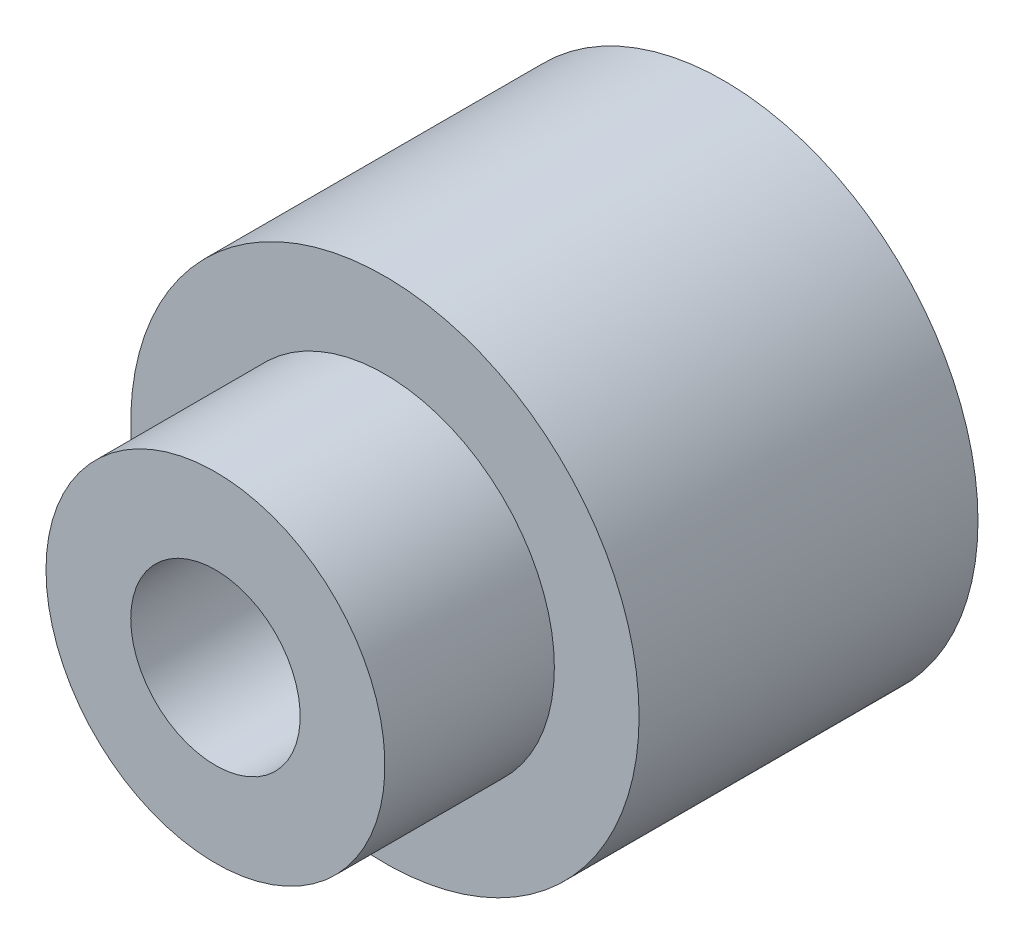
from build123d import *

# Parameters (mm, degrees)
SKETCH1_R                  = 15
BOSS_EXTRUDE1_DEPTH        = 10
SKETCH2_R                  = 10
CUT_EXTRUDE1_DEPTH         = 20
SKETCH3_R                  = 15
BOSS_EXTRUDE2_DEPTH        = 10
SKETCH5_R                  = 10
CUT_EXTRUDE3_DEPTH         = 8
SKETCH8_W                  = 0.75
SKETCH8_H                  = 0.75
CUT_EXTRUDE5_DEPTH         = 2
FILL_START                 = -1.125
FILL_PATTERN2_OUTLINE_W    = 0.75
FILL_PATTERN2_OUTLINE_H    = 2
FILL_PATTERN2_DEPTH        = 0.75
FILL_START_2               = 0.375
FILL_PATTERN2_2_OUTLINE_W  = 0.75
FILL_PATTERN2_2_OUTLINE_H  = 2
FILL_PATTERN2_2_DEPTH      = 0.75
FILL_START_3               = -3.375
FILL_PATTERN2_3_OUTLINE_W  = 0.75
FILL_PATTERN2_3_OUTLINE_H  = 2
FILL_PATTERN2_3_DEPTH      = 0.75
FILL_START_4               = -1.875
FILL_PATTERN2_4_OUTLINE_W  = 0.75
FILL_PATTERN2_4_OUTLINE_H  = 2
FILL_PATTERN2_4_DEPTH      = 0.75
FILL_START_5               = 1.125
FILL_PATTERN2_5_OUTLINE_W  = 0.75
FILL_PATTERN2_5_OUTLINE_H  = 2
FILL_PATTERN2_5_DEPTH      = 0.75
FILL_START_6               = 2.625
FILL_PATTERN2_6_OUTLINE_W  = 0.75
FILL_PATTERN2_6_OUTLINE_H  = 2
FILL_PATTERN2_6_DEPTH      = 0.75
FILL_START_7               = -4.125
FILL_PATTERN2_7_OUTLINE_W  = 0.75
FILL_PATTERN2_7_OUTLINE_H  = 2
FILL_PATTERN2_7_DEPTH      = 0.75
FILL_START_8               = -2.625
FILL_PATTERN2_8_OUTLINE_W  = 0.75
FILL_PATTERN2_8_OUTLINE_H  = 2
FILL_PATTERN2_8_DEPTH      = 0.75
FILL_START_9               = -0.375
FILL_PATTERN2_9_OUTLINE_W  = 0.75
FILL_PATTERN2_9_OUTLINE_H  = 2
FILL_PATTERN2_9_DEPTH      = 0.75
FILL_START_10              = 1.875
FILL_PATTERN2_10_OUTLINE_W = 0.75
FILL_PATTERN2_10_OUTLINE_H = 2
FILL_PATTERN2_10_DEPTH     = 0.75
FILL_START_11              = 3.375
FILL_PATTERN2_11_OUTLINE_W = 0.75
FILL_PATTERN2_11_OUTLINE_H = 2
FILL_PATTERN2_11_DEPTH     = 0.75
SKETCH12_W                 = 18
SKETCH12_H                 = 5


# Read off the part's stored shape, not the designer's step: Fill Pattern2
with BuildPart() as part:
    # Sketch1 → Boss-Extrude1 (new body)
    with BuildSketch(Plane.XY):
        Circle(SKETCH1_R)
    extrude(amount=BOSS_EXTRUDE1_DEPTH)

    # Sketch2 → Cut-Extrude1 (cut)
    with BuildSketch(Plane.XY.offset(10)):
        Circle(SKETCH2_R)
    extrude(amount=-CUT_EXTRUDE1_DEPTH, mode=Mode.SUBTRACT)

    # Sketch3 → Boss-Extrude2 (add)
    with BuildSketch(Plane.XY.offset(10)):
        Circle(SKETCH3_R)
    extrude(amount=BOSS_EXTRUDE2_DEPTH)

    # Sketch5 → Cut-Extrude3 (cut)
    with BuildSketch(Plane.XY.offset(20)):
        Circle(SKETCH5_R)
    extrude(amount=-CUT_EXTRUDE3_DEPTH, mode=Mode.SUBTRACT)

    # Sketch8 → Cut-Extrude5 (cut)
    with BuildSketch(Plane(origin=(0, 0, 10), x_dir=(-1, 0, 0), z_dir=(0, 0, -1))):
        Rectangle(SKETCH8_W, SKETCH8_H)
    extrude(amount=-CUT_EXTRUDE5_DEPTH, mode=Mode.SUBTRACT)

    # Fill Pattern2 outline → Fill Pattern2 (cut)
    with BuildSketch(Plane.YZ.offset(FILL_START)):
        with Locations((-1.299038106, 11)):
            Rectangle(FILL_PATTERN2_OUTLINE_W, FILL_PATTERN2_OUTLINE_H)
        with Locations((1.299038106, 11)):
            Rectangle(FILL_PATTERN2_OUTLINE_W, FILL_PATTERN2_OUTLINE_H)
        with Locations((-3.897114317, 11)):
            Rectangle(FILL_PATTERN2_OUTLINE_W, FILL_PATTERN2_OUTLINE_H)
        with Locations((3.897114317, 11)):
            Rectangle(FILL_PATTERN2_OUTLINE_W, FILL_PATTERN2_OUTLINE_H)
    extrude(amount=FILL_PATTERN2_DEPTH, mode=Mode.SUBTRACT)

    # Fill Pattern2 2 outline → Fill Pattern2 2 (cut)
    with BuildSketch(Plane.YZ.offset(FILL_START_2)):
        with Locations((-1.299038106, 11)):
            Rectangle(FILL_PATTERN2_2_OUTLINE_W, FILL_PATTERN2_2_OUTLINE_H)
        with Locations((1.299038106, 11)):
            Rectangle(FILL_PATTERN2_2_OUTLINE_W, FILL_PATTERN2_2_OUTLINE_H)
        with Locations((-3.897114317, 11)):
            Rectangle(FILL_PATTERN2_2_OUTLINE_W, FILL_PATTERN2_2_OUTLINE_H)
        with Locations((3.897114317, 11)):
            Rectangle(FILL_PATTERN2_2_OUTLINE_W, FILL_PATTERN2_2_OUTLINE_H)
    extrude(amount=FILL_PATTERN2_2_DEPTH, mode=Mode.SUBTRACT)

    # Fill Pattern2 3 outline → Fill Pattern2 3 (cut)
    with BuildSketch(Plane.YZ.offset(FILL_START_3)):
        with Locations((0, 11)):
            Rectangle(FILL_PATTERN2_3_OUTLINE_W, FILL_PATTERN2_3_OUTLINE_H)
        with Locations((-2.598076211, 11)):
            Rectangle(FILL_PATTERN2_3_OUTLINE_W, FILL_PATTERN2_3_OUTLINE_H)
        with Locations((2.598076211, 11)):
            Rectangle(FILL_PATTERN2_3_OUTLINE_W, FILL_PATTERN2_3_OUTLINE_H)
    extrude(amount=FILL_PATTERN2_3_DEPTH, mode=Mode.SUBTRACT)

    # Fill Pattern2 4 outline → Fill Pattern2 4 (cut)
    with BuildSketch(Plane.YZ.offset(FILL_START_4)):
        with Locations((0, 11)):
            Rectangle(FILL_PATTERN2_4_OUTLINE_W, FILL_PATTERN2_4_OUTLINE_H)
        with Locations((-2.598076211, 11)):
            Rectangle(FILL_PATTERN2_4_OUTLINE_W, FILL_PATTERN2_4_OUTLINE_H)
        with Locations((2.598076211, 11)):
            Rectangle(FILL_PATTERN2_4_OUTLINE_W, FILL_PATTERN2_4_OUTLINE_H)
    extrude(amount=FILL_PATTERN2_4_DEPTH, mode=Mode.SUBTRACT)

    # Fill Pattern2 5 outline → Fill Pattern2 5 (cut)
    with BuildSketch(Plane.YZ.offset(FILL_START_5)):
        with Locations((0, 11)):
            Rectangle(FILL_PATTERN2_5_OUTLINE_W, FILL_PATTERN2_5_OUTLINE_H)
        with Locations((-2.598076211, 11)):
            Rectangle(FILL_PATTERN2_5_OUTLINE_W, FILL_PATTERN2_5_OUTLINE_H)
        with Locations((2.598076211, 11)):
            Rectangle(FILL_PATTERN2_5_OUTLINE_W, FILL_PATTERN2_5_OUTLINE_H)
    extrude(amount=FILL_PATTERN2_5_DEPTH, mode=Mode.SUBTRACT)

    # Fill Pattern2 6 outline → Fill Pattern2 6 (cut)
    with BuildSketch(Plane.YZ.offset(FILL_START_6)):
        with Locations((0, 11)):
            Rectangle(FILL_PATTERN2_6_OUTLINE_W, FILL_PATTERN2_6_OUTLINE_H)
        with Locations((-2.598076211, 11)):
            Rectangle(FILL_PATTERN2_6_OUTLINE_W, FILL_PATTERN2_6_OUTLINE_H)
        with Locations((2.598076211, 11)):
            Rectangle(FILL_PATTERN2_6_OUTLINE_W, FILL_PATTERN2_6_OUTLINE_H)
    extrude(amount=FILL_PATTERN2_6_DEPTH, mode=Mode.SUBTRACT)

    # Fill Pattern2 7 outline → Fill Pattern2 7 (cut)
    with BuildSketch(Plane.YZ.offset(FILL_START_7)):
        with Locations((-1.299038106, 11)):
            Rectangle(FILL_PATTERN2_7_OUTLINE_W, FILL_PATTERN2_7_OUTLINE_H)
        with Locations((1.299038106, 11)):
            Rectangle(FILL_PATTERN2_7_OUTLINE_W, FILL_PATTERN2_7_OUTLINE_H)
    extrude(amount=FILL_PATTERN2_7_DEPTH, mode=Mode.SUBTRACT)

    # Fill Pattern2 8 outline → Fill Pattern2 8 (cut)
    with BuildSketch(Plane.YZ.offset(FILL_START_8)):
        with Locations((-1.299038106, 11)):
            Rectangle(FILL_PATTERN2_8_OUTLINE_W, FILL_PATTERN2_8_OUTLINE_H)
        with Locations((1.299038106, 11)):
            Rectangle(FILL_PATTERN2_8_OUTLINE_W, FILL_PATTERN2_8_OUTLINE_H)
    extrude(amount=FILL_PATTERN2_8_DEPTH, mode=Mode.SUBTRACT)

    # Fill Pattern2 9 outline → Fill Pattern2 9 (cut)
    with BuildSketch(Plane.YZ.offset(FILL_START_9)):
        with Locations((-2.598076211, 11)):
            Rectangle(FILL_PATTERN2_9_OUTLINE_W, FILL_PATTERN2_9_OUTLINE_H)
        with Locations((2.598076211, 11)):
            Rectangle(FILL_PATTERN2_9_OUTLINE_W, FILL_PATTERN2_9_OUTLINE_H)
    extrude(amount=FILL_PATTERN2_9_DEPTH, mode=Mode.SUBTRACT)

    # Fill Pattern2 10 outline → Fill Pattern2 10 (cut)
    with BuildSketch(Plane.YZ.offset(FILL_START_10)):
        with Locations((-1.299038106, 11)):
            Rectangle(FILL_PATTERN2_10_OUTLINE_W, FILL_PATTERN2_10_OUTLINE_H)
        with Locations((1.299038106, 11)):
            Rectangle(FILL_PATTERN2_10_OUTLINE_W, FILL_PATTERN2_10_OUTLINE_H)
    extrude(amount=FILL_PATTERN2_10_DEPTH, mode=Mode.SUBTRACT)

    # Fill Pattern2 11 outline → Fill Pattern2 11 (cut)
    with BuildSketch(Plane.YZ.offset(FILL_START_11)):
        with Locations((-1.299038106, 11)):
            Rectangle(FILL_PATTERN2_11_OUTLINE_W, FILL_PATTERN2_11_OUTLINE_H)
        with Locations((1.299038106, 11)):
            Rectangle(FILL_PATTERN2_11_OUTLINE_W, FILL_PATTERN2_11_OUTLINE_H)
    extrude(amount=FILL_PATTERN2_11_DEPTH, mode=Mode.SUBTRACT)

    # Sketch12 → Revolve2 (revolve)
    with BuildSketch(Plane(origin=(0, 0, 0), x_dir=(0, 0, -1), z_dir=(1, 0, 0)), mode=Mode.PRIVATE) as revolve2_sk:
        with Locations((-21, -7.5)):
            Rectangle(SKETCH12_W, SKETCH12_H)
    revolve(revolve2_sk.sketch.rotate(Axis((0, 0, 0), (0, 0, 1)), 270), axis=Axis((0, 0, 0), (0, 0, 1)))


solid = part.part
